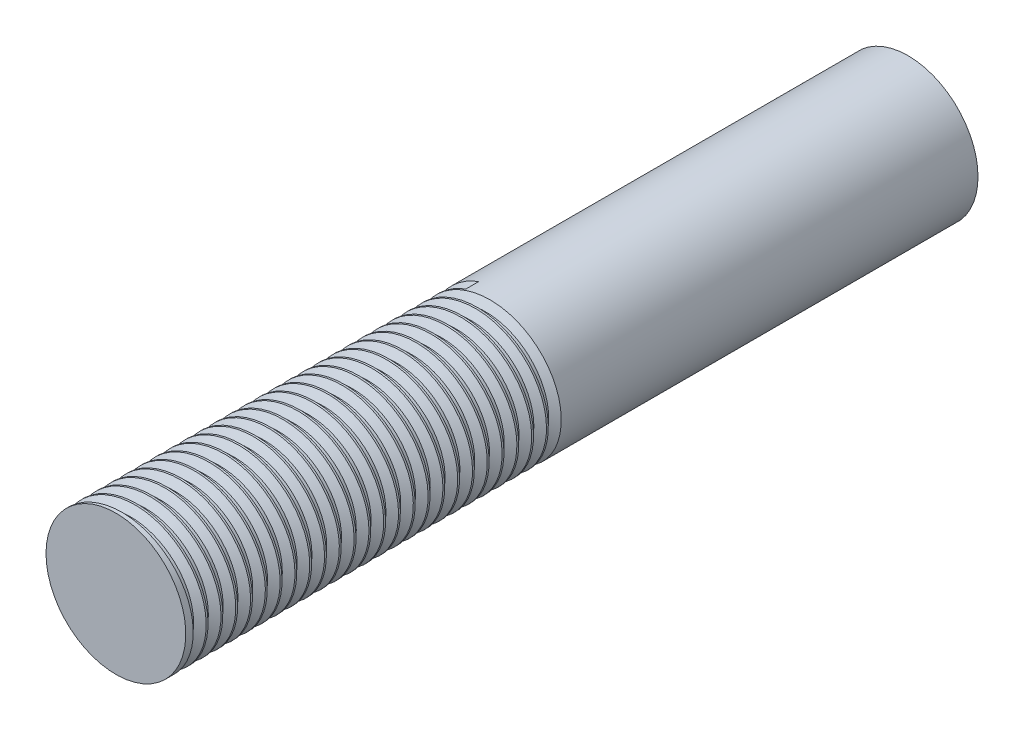
from build123d import *

# Parameters (mm, degrees)
SKETCH1_R           = 1.5
BOSS_EXTRUDE1_DEPTH = 17
THREAD1_PITCH       = 0.3175


with BuildPart() as part:
    # Sketch1 → Boss-Extrude1 (new body)
    with BuildSketch(Plane.XY):
        Circle(SKETCH1_R)
    extrude(amount=BOSS_EXTRUDE1_DEPTH)

    # Thread1: the profile of Thread Profile1 profile screwed along a right-hand helix of 25.19685 turns, 6 arcs to a turn; built about Z, then put on its axis
    thread1_z = Axis((0, 0, 0), (0, 0, 1))
    thread1_corners = [(1.5003, 0, -0.000173205), (1.5003, 0, 0.277985704), (1.328148085, 0, 0.17859375), (1.328148085, 0, 0.09921875)]
    with BuildLine(mode=Mode.PRIVATE) as thread1_profile:
        Line(thread1_corners[0], thread1_corners[1])
        Line(thread1_corners[1], thread1_corners[2])
        Line(thread1_corners[2], thread1_corners[3])
        Line(thread1_corners[3], thread1_corners[0])
    thread1_cap = Face(thread1_profile.wire())
    thread1_turn_angles = [0, 30, 60, 90, 120, 150, 180, 210, 240, 270, 300, 330, 360]
    thread1_turn_weights = [1, 0.8660254037844387, 1, 0.8660254037844387, 1, 0.8660254037844387, 1, 0.8660254037844387, 1, 0.8660254037844387, 1, 0.8660254037844387, 1]
    thread1_turn_rails = [Edge.make_bspline([Vector(p[0], p[1], 0).rotate(thread1_z, thread1_turn_angles[k]) / thread1_turn_weights[k] + Vector(0, 0, p[2] + THREAD1_PITCH * thread1_turn_angles[k] / 360) for k in range(13)], [0, 0, 0, 1, 1, 2, 2, 3, 3, 4, 4, 5, 5, 6, 6, 6], 2, thread1_turn_weights) for p in thread1_corners]
    thread1_turn_sides = [Face.make_surface_from_curves(thread1_turn_rails[p[0]], thread1_turn_rails[p[1]]) for p in [(0, 1), (1, 2), (2, 3), (3, 0)]]
    thread1_last_angles = [9000, 9030, 9060, 9065.433070866, 9070.866141732]
    thread1_last_weights = [1, 0.8660254037844387, 1, 0.9955074798730315, 1]
    thread1_last_rails = [Edge.make_bspline([Vector(p[0], p[1], 0).rotate(thread1_z, thread1_last_angles[k]) / thread1_last_weights[k] + Vector(0, 0, p[2] + THREAD1_PITCH * thread1_last_angles[k] / 360) for k in range(5)], [0, 0, 0, 1, 1, 2, 2, 2], 2, thread1_last_weights) for p in thread1_corners]
    thread1_last_sides = [Face.make_surface_from_curves(thread1_last_rails[p[0]], thread1_last_rails[p[1]]) for p in [(0, 1), (1, 2), (2, 3), (3, 0)]]
    thread1 = Plane(origin=(0, 0, 17), x_dir=(-1, 0, 0), z_dir=(0, 0, -1)) * Solid(Shell([*[p.moved(Location((0, 0, THREAD1_PITCH * i))) for i in range(25) for p in thread1_turn_sides], *thread1_last_sides, thread1_cap, thread1_cap.rotate(thread1_z, 9070.866141732).moved(Location((0, 0, THREAD1_PITCH * 9070.866141732 / 360)))]))
    add(thread1, mode=Mode.SUBTRACT)


solid = part.part
